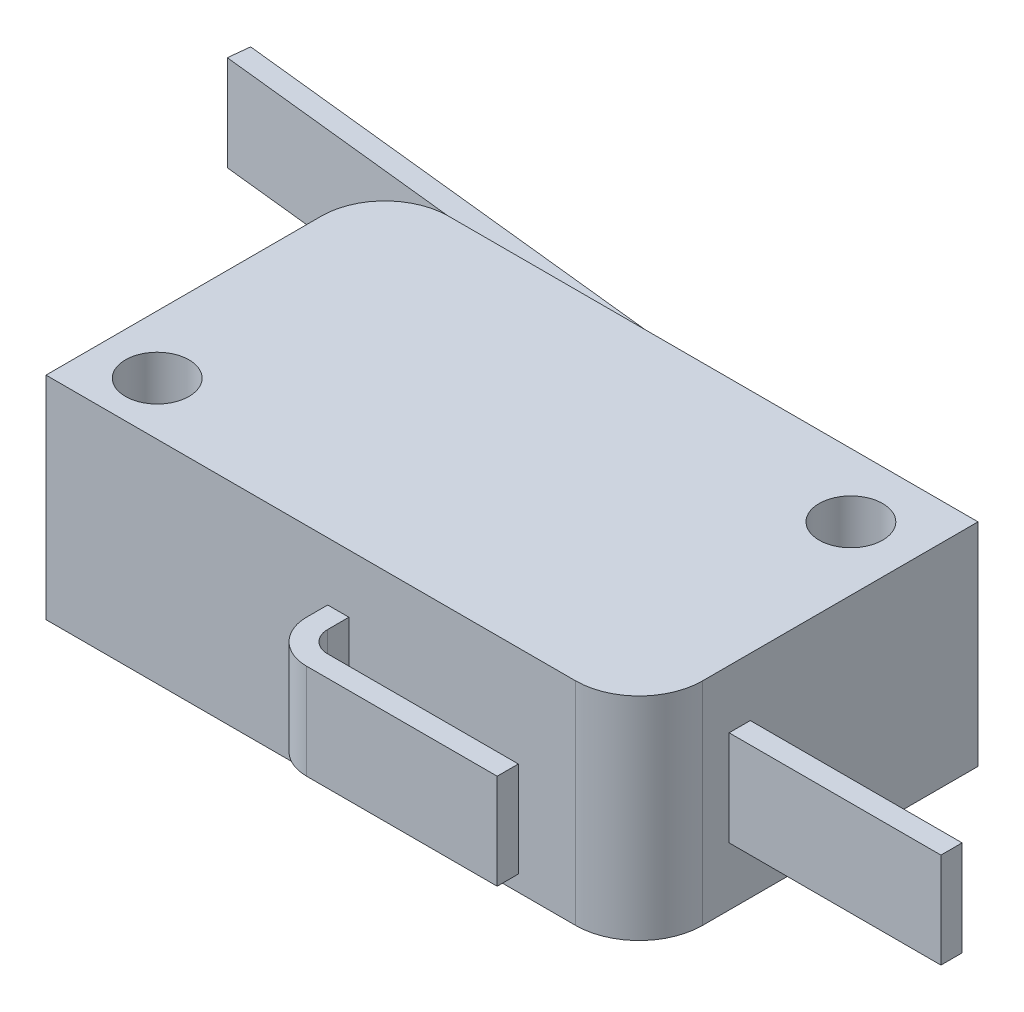
from build123d import *

# Parameters (mm, degrees)
SKETCH1_R           = 1.5
BOSS_EXTRUDE1_DEPTH = 5
SKETCH1_3_W         = 10
SKETCH1_3_H         = 1
EXTRUDE_THIN1_DEPTH = 2.25


with BuildPart() as part:
    # Sketch1 → Boss-Extrude1 (new, symmetric)
    with BuildSketch(Plane(origin=(0, 0, 0), x_dir=(1, 0, 0), z_dir=(0, 1, 0))):
        with BuildLine():
            Line((-14, 5), (-14, -8))
            Line((-14, -8), (0.3, -8))
            Line((0.3, -8), (11, -8))
            ThreePointArc((11, -8), (13.121320344, -7.121320344), (14, -5))
            Line((14, -5), (14, -2.75))
            Line((14, -2.75), (14, 8))
            Line((14, 8), (2.5, 8))
            Line((2.5, 8), (-11, 8))
            ThreePointArc((-11, 8), (-13.121320344, 7.121320344), (-14, 5))
        make_face()
        with Locations((-11.25, -5.5)):
            Circle(SKETCH1_R, mode=Mode.SUBTRACT)
        with Locations((11, 5)):
            Circle(SKETCH1_R, mode=Mode.SUBTRACT)
    extrude(amount=BOSS_EXTRUDE1_DEPTH, both=True)

    # Sketch1<3> → Extrude-Thin1 (add, symmetric)
    with BuildSketch(Plane(origin=(0, 0, 0), x_dir=(1, 0, 0), z_dir=(0, 1, 0))):
        with BuildLine():
            Line((-25.338821814, 13), (1.607142857, 10.096217126))
            ThreePointArc((1.607142857, 10.096217126), (2.244023809, 9.770126595), (2.5, 9.10197349))
            Line((2.5, 9.10197349), (2.5, 8))
            Line((2.5, 8), (1.5, 8))
            Line((1.5, 8), (1.5, 9.10197349))
            Line((1.5, 9.10197349), (-25.445964671, 12.005756364))
            Line((-25.445964671, 12.005756364), (-25.338821814, 13))
        make_face()
        with BuildLine():
            Line((0.3, -8), (0.3, -9))
            ThreePointArc((0.3, -9), (0.592893219, -9.707106781), (1.3, -10))
            Line((1.3, -10), (10.3, -10))
            Line((10.3, -10), (10.3, -11))
            Line((10.3, -11), (1.3, -11))
            ThreePointArc((1.3, -11), (-0.114213562, -10.414213562), (-0.7, -9))
            Line((-0.7, -9), (-0.7, -8))
            Line((-0.7, -8), (0.3, -8))
        make_face()
        with Locations((19, -3.25)):
            Rectangle(SKETCH1_3_W, SKETCH1_3_H)
    extrude(amount=EXTRUDE_THIN1_DEPTH, both=True)


solid = part.part
